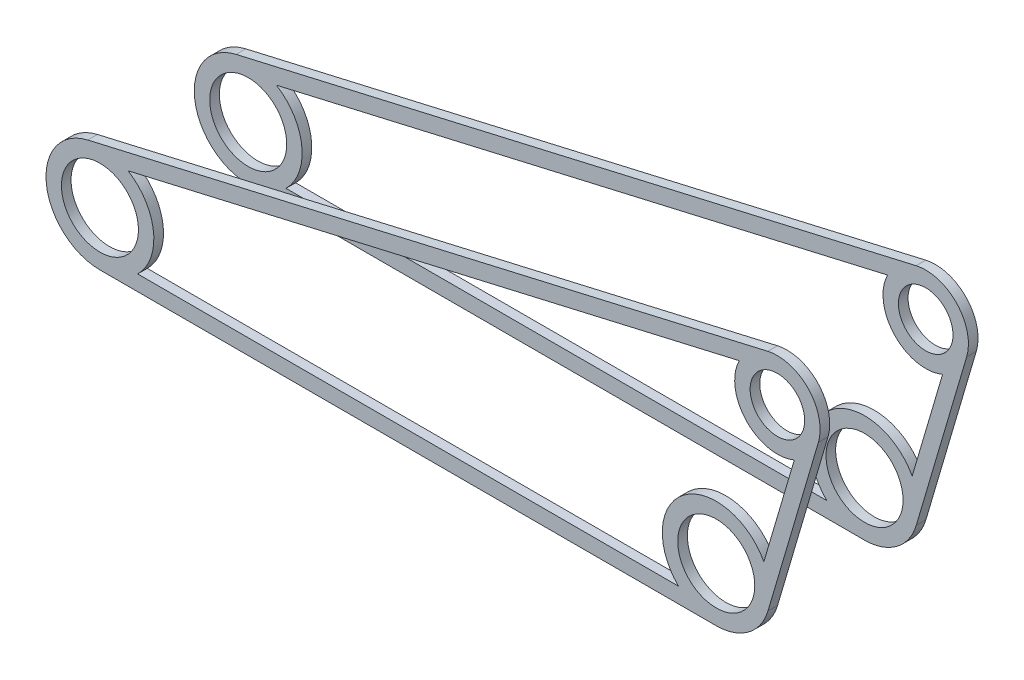
from build123d import *

# Parameters (mm, degrees)
BOSS_EXTRUDE1_START = 11.43
SKETCH1_R           = 6.35
SKETCH1_R_2         = 4.5
BOSS_EXTRUDE1_DEPTH = 1.5875
BOSS_EXTRUDE2_START = -11.43
SKETCH1_4_R         = 6.35
SKETCH1_4_R_2       = 4.5
BOSS_EXTRUDE2_DEPTH = 1.5875


with BuildPart() as part:
    # Sketch1 → Boss-Extrude1 (new body)
    with BuildSketch(Plane.XY.offset(BOSS_EXTRUDE1_START)):
        with BuildLine():
            ThreePointArc((-2.000046185, 8.66209647), (-8.832840359, -1.006494506), (0, -8.89))
            Line((0, -8.89), (101.6, -8.89))
            ThreePointArc((101.6, -8.89), (106.924760251, -7.118920443), (110.127906547, -2.511356192))
            Line((110.127906547, -2.511356192), (118.434835328, 25.696793875))
            ThreePointArc((118.434835328, 25.696793875), (116.805412738, 32.513366274), (110.097738901, 34.54506235))
            Line((110.097738901, 34.54506235), (-2.000046185, 8.66209647))
        make_face()
        Circle(SKETCH1_R, mode=Mode.SUBTRACT)
        with BuildLine():
            Line((4.633600284, 7.586952511), (105.393955305, 30.852147529))
            ThreePointArc((105.393955305, 30.852147529), (106.557742262, 22.857712499), (114.468872182, 21.220820649))
            Line((114.468872182, 21.220820649), (109.448945029, 4.174465467))
            ThreePointArc((109.448945029, 4.174465467), (96.275239749, 7.118920443), (95.378296053, -6.35))
            Line((95.378296053, -6.35), (6.221703947, -6.35))
            ThreePointArc((6.221703947, -6.35), (8.832840359, 1.006494506), (4.633600284, 7.586952511))
        make_face(mode=Mode.SUBTRACT)
        with Locations((111.6815775, 27.685539386)):
            Circle(SKETCH1_R_2, mode=Mode.SUBTRACT)
        with Locations((101.6, 0)):
            Circle(SKETCH1_R, mode=Mode.SUBTRACT)
    extrude(amount=BOSS_EXTRUDE1_DEPTH)


with BuildPart() as body_2:
    # Sketch1<4> → Boss-Extrude2 (new body)
    with BuildSketch(Plane.XY.offset(BOSS_EXTRUDE2_START)):
        with BuildLine():
            ThreePointArc((-2.000046185, 8.66209647), (-8.832840359, -1.006494506), (0, -8.89))
            Line((0, -8.89), (101.6, -8.89))
            ThreePointArc((101.6, -8.89), (106.924760251, -7.118920443), (110.127906547, -2.511356192))
            Line((110.127906547, -2.511356192), (118.434835328, 25.696793875))
            ThreePointArc((118.434835328, 25.696793875), (116.805412738, 32.513366274), (110.097738901, 34.54506235))
            Line((110.097738901, 34.54506235), (-2.000046185, 8.66209647))
        make_face()
        Circle(SKETCH1_4_R, mode=Mode.SUBTRACT)
        with BuildLine():
            Line((4.633600284, 7.586952511), (105.393955305, 30.852147529))
            ThreePointArc((105.393955305, 30.852147529), (106.557742262, 22.857712499), (114.468872182, 21.220820649))
            Line((114.468872182, 21.220820649), (109.448945029, 4.174465467))
            ThreePointArc((109.448945029, 4.174465467), (96.275239749, 7.118920443), (95.378296053, -6.35))
            Line((95.378296053, -6.35), (6.221703947, -6.35))
            ThreePointArc((6.221703947, -6.35), (8.832840359, 1.006494506), (4.633600284, 7.586952511))
        make_face(mode=Mode.SUBTRACT)
        with Locations((111.6815775, 27.685539386)):
            Circle(SKETCH1_4_R_2, mode=Mode.SUBTRACT)
        with Locations((101.6, 0)):
            Circle(SKETCH1_4_R, mode=Mode.SUBTRACT)
    extrude(amount=-BOSS_EXTRUDE2_DEPTH)


solid = Compound([part.part, body_2.part])
